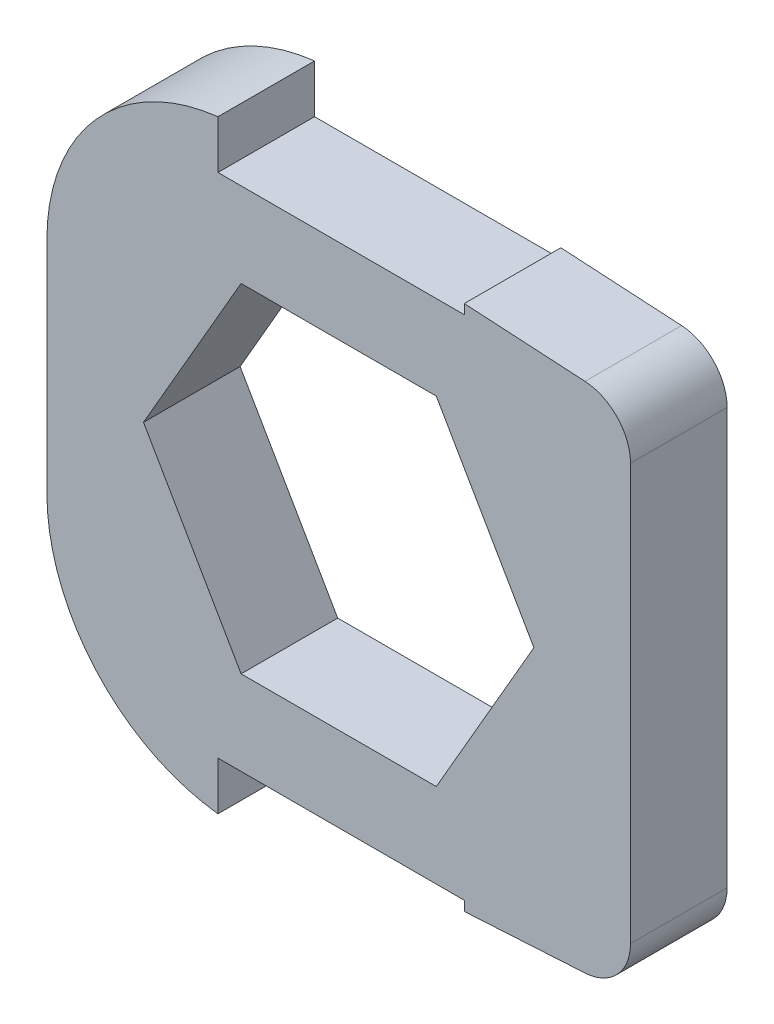
from build123d import *

# Parameters (mm, degrees)
BOSS_EXTRU_1_DEPTH = 2
CONG_1_R           = 4
CONG_2_R           = 1


with BuildPart() as part:
    # Esquisse1 → Boss.-Extru.1 (new body)
    with BuildSketch(Plane.XY):
        Polygon((0, 6.25), (3.541451884, 6.25), (3.541451884, 5.25), (8.641451884, 5.25), (8.641451884, 5.45), (12.082903769, 5.25), (12.082903769, -5.25), (8.641451884, -5.45), (8.641451884, -5.25), (3.541451884, -5.25), (3.541451884, -6.25), (0, -6.25), align=None)
        Polygon((2, 0), (4.020725942, -3.5), (8.062177826, -3.5), (10.082903769, 0), (8.062177826, 3.5), (4.020725942, 3.5), align=None, mode=Mode.SUBTRACT)
    extrude(amount=BOSS_EXTRU_1_DEPTH)

    # Congé1
    # the kernel refuses this fillet: 4 mm, written as the material it takes off along each edge
    with BuildSketch(Plane(origin=(0, -6.25, -9.934074449), x_dir=(1, 0, 0), z_dir=(0, 0, 1))) as cong_1_piece_1:
        with BuildLine():
            CenterArc((4, 3.97362978), CONG_1_R, 180, 83.417310117)
            Line((0, 3.97362978), (-0.08, 3.97362978))
            Line((-0.08, 3.97362978), (-0.08, 0))
            Line((-0.08, 0), (0, -0.08))
            ThreePointArc((0, -0.08), (1.770725942, -0.08), (3.532280922, -0.079472596))
            Line((3.532280922, -0.079472596), (3.541451884, 0))
        make_face()
    extrude(amount=21.868148898, mode=Mode.SUBTRACT)
    with BuildSketch(Plane(origin=(0, 6.25, -9.934074449), x_dir=(1, 0, 0), z_dir=(0, 0, 1))) as cong_1_piece_2:
        with BuildLine():
            CenterArc((4, -3.97362978), CONG_1_R, 96.582689883, 83.417310117)
            Line((0, -3.97362978), (-0.08, -3.97362978))
            Line((-0.08, -3.97362978), (-0.08, 0))
            Line((-0.08, 0), (0, 0.08))
            ThreePointArc((0, 0.08), (1.770725942, 0.08), (3.532280922, 0.079472596))
            Line((3.532280922, 0.079472596), (3.541451884, 0))
        make_face()
    extrude(amount=21.868148898, mode=Mode.SUBTRACT)

    # Congé2
    cong_2_edges = [part.edges().sort_by_distance(p)[0] for p in [
        (12.082903769, 5.25, 1),
        (12.082903769, -5.25, 1),
    ]]
    fillet(cong_2_edges, radius=CONG_2_R)


solid = part.part
